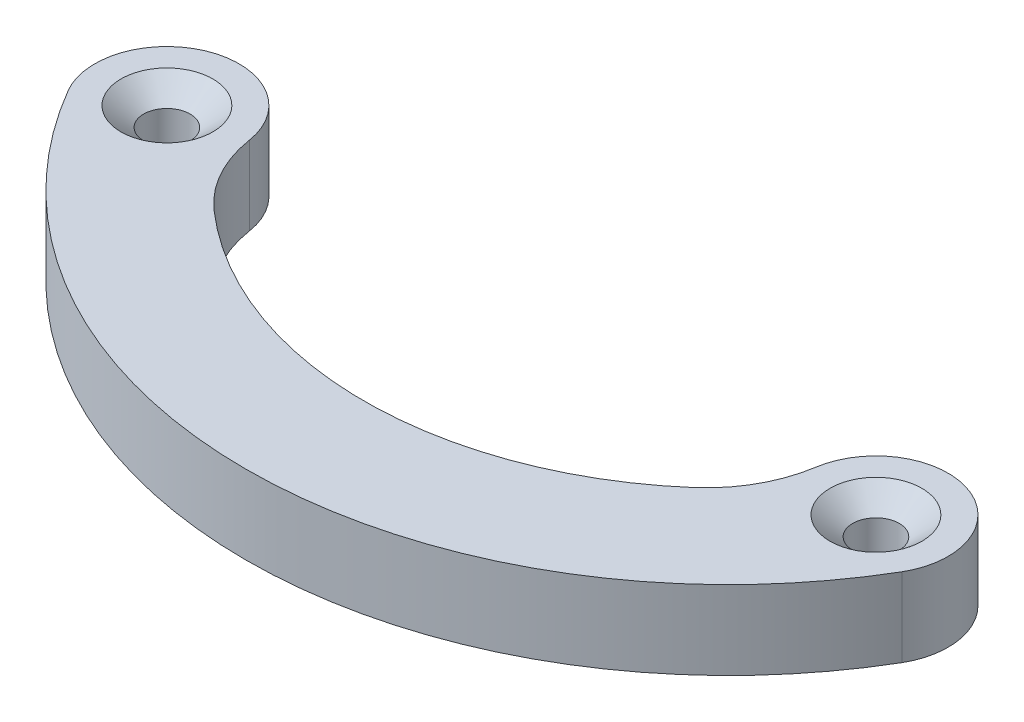
from build123d import *

# Parameters (mm, degrees)
BOSS_EXTRUDE1_DEPTH                               = 7.62
CSK_FOR_8_FLAT_HEAD_MACHINE_SCREW_100_D           = 4.4958
CSK_FOR_8_FLAT_HEAD_MACHINE_SCREW_100_CSINK_D     = 8.89
CSK_FOR_8_FLAT_HEAD_MACHINE_SCREW_100_CSINK_ANGLE = 100


with BuildPart() as part:
    # Sketch1 → Boss-Extrude1 (new body)
    with BuildSketch(Plane(origin=(0, 0, 0), x_dir=(1, 0, 0), z_dir=(0, 1, 0))):
        with BuildLine():
            Line((0, -35.306), (0, -46.736))
            ThreePointArc((0, -46.736), (23.255743146, -40.539167563), (40.344422638, -23.591974441))
            ThreePointArc((40.344422638, -23.591974441), (36.657015387, -13.485444098), (27.413193037, -18.98914069))
            ThreePointArc((27.413193037, -18.98914069), (25.985902712, -23.164409175), (23.216162353, -26.599312803))
            ThreePointArc((23.216162353, -26.599312803), (12.397546091, -33.057744734), (0, -35.306))
        make_face()
    extrude(amount=BOSS_EXTRUDE1_DEPTH)

    # CSK for #8 Flat Head Machine Screw (100)1 (through all)
    with Locations(Plane(origin=(0, 7.62, 0), x_dir=(1, 0, 0), z_dir=(0, 1, 0))):
        with Locations((34.314685559, -20.066)):
            CounterSinkHole(CSK_FOR_8_FLAT_HEAD_MACHINE_SCREW_100_D / 2, CSK_FOR_8_FLAT_HEAD_MACHINE_SCREW_100_CSINK_D / 2, counter_sink_angle=CSK_FOR_8_FLAT_HEAD_MACHINE_SCREW_100_CSINK_ANGLE)

    # Mirror1: part across plane


with BuildPart() as part_1:
    add(part.part)
    add(part.part.mirror(Plane(origin=(0, 0, 0), x_dir=(0, 0, 1), z_dir=(1, 0, 0))))


solid = part_1.part
